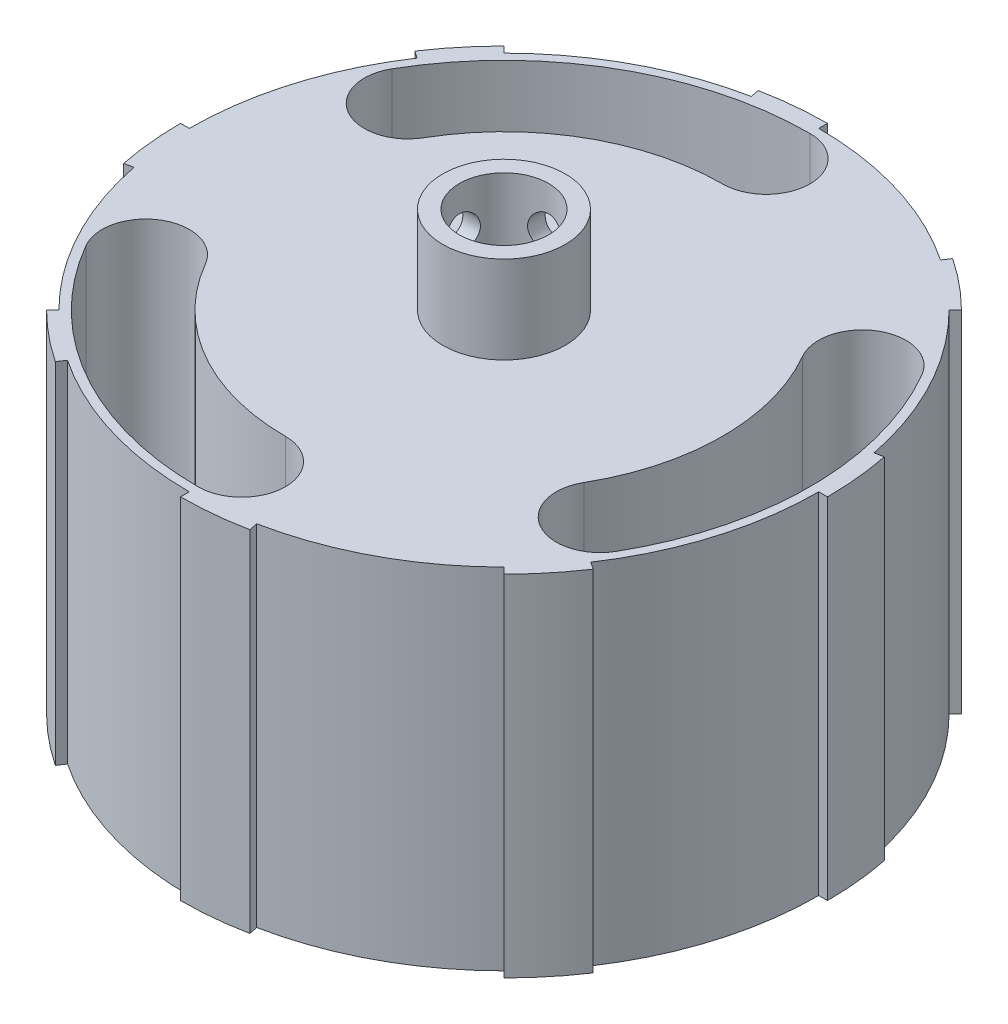
from build123d import *

# Parameters (mm, degrees)
SKETCH_1_R          = 37
EXTRUDE_1_DEPTH     = 40
SKETCH_2_R          = 5.1
CUT_EXTRUDE_1_DEPTH = 40
CUT_EXTRUDE_2_DEPTH = 40
SKETCH_4_R          = 7
SKETCH_4_R_2        = 5.1
EXTRUDE_2_DEPTH     = 10
CUT_EXTRUDE_3_REACH = 74.374
CUT_EXTRUDE_4_REACH = 74.374
CUT_EXTRUDE_7_REACH = 74.374


with BuildPart() as part:
    # 草图1 → 凸台-拉伸1 (new body)
    with BuildSketch(Plane(origin=(0, 0, 0), x_dir=(1, 0, 0), z_dir=(0, 1, 0))):
        Circle(SKETCH_1_R)
    extrude(amount=EXTRUDE_1_DEPTH)

    # 草图2 → 切除-拉伸1 (cut)
    with BuildSketch(Plane(origin=(0, 40, 0), x_dir=(1, 0, 0), z_dir=(0, 1, 0))):
        Circle(SKETCH_2_R)
    extrude(amount=-CUT_EXTRUDE_1_DEPTH, mode=Mode.SUBTRACT)

    # 草图3 → 切除-拉伸2 (cut)
    with BuildSketch(Plane(origin=(0, 40, 0), x_dir=(1, 0, 0), z_dir=(0, 1, 0))):
        with BuildLine():
            ThreePointArc((21.650635067, -12.500000048), (23.480762153, -19.330127042), (30.31088915, -17.499999969))
            ThreePointArc((30.31088915, -17.499999969), (35, 0), (30.31088915, 17.499999969))
            ThreePointArc((30.31088915, 17.499999969), (23.48076214, 19.330127034), (21.650635082, 12.500000023))
            ThreePointArc((21.650635082, 12.500000023), (25, -1.5e-08), (21.650635067, -12.500000048))
        make_face()
        with BuildLine():
            ThreePointArc((-4e-09, 25), (5, 30.000000012), (-2.8e-08, 35))
            ThreePointArc((-2.8e-08, 35), (-17.500000023, 30.310889119), (-30.310889145, 17.499999978))
            ThreePointArc((-30.310889145, 17.499999978), (-28.480762154, 10.669873005), (-21.650635155, 12.499999896))
            ThreePointArc((-21.650635155, 12.499999896), (-12.500000054, 21.650635064), (-4e-09, 25))
        make_face()
        with BuildLine():
            ThreePointArc((1.4e-07, -35), (5, -29.99999992), (-1.9e-08, -25))
            ThreePointArc((-1.9e-08, -25), (-12.499999982, -21.650635105), (-21.650635064, -12.500000053))
            ThreePointArc((-21.650635064, -12.500000053), (-28.480762025, -10.66987293), (-30.310889204, -17.499999877))
            ThreePointArc((-30.310889204, -17.499999877), (-17.500000001, -30.310889132), (1.4e-07, -35))
        make_face()
    extrude(amount=-CUT_EXTRUDE_2_DEPTH, mode=Mode.SUBTRACT)

    # 草图4 → 凸台-拉伸2 (add, symmetric)
    with BuildSketch(Plane(origin=(0, 40, 0), x_dir=(1, 0, 0), z_dir=(0, 1, 0))):
        Circle(SKETCH_4_R)
        Circle(SKETCH_4_R_2, mode=Mode.SUBTRACT)
    extrude(amount=EXTRUDE_2_DEPTH, both=True)

    # 草图6 → 切除-拉伸3 (cut, up to next)
    with BuildSketch(Plane.XY, mode=Mode.PRIVATE) as cut_extrude_3_sk1:
        with BuildLine():
            ThreePointArc((0, 47), (-1.414213562, 43.585786438), (2, 45))
            ThreePointArc((2, 45), (1.414213562, 46.414213562), (0, 47))
        make_face()
    cut_extrude_3_tool1 = extrude(cut_extrude_3_sk1.sketch, amount=-CUT_EXTRUDE_3_REACH, mode=Mode.PRIVATE) & part.part
    add(cut_extrude_3_tool1.solids().sort_by_distance((0, 45, 0))[0], mode=Mode.SUBTRACT)

    # 草图7 → 切除-拉伸4 (cut, up to next)
    with BuildSketch(Plane(origin=(0, 0, 0), x_dir=(0, 0, -1), z_dir=(1, 0, 0)), mode=Mode.PRIVATE) as cut_extrude_4_sk1:
        with BuildLine():
            ThreePointArc((0, 47), (-1.414213562, 43.585786438), (2, 45))
            ThreePointArc((2, 45), (1.414213562, 46.414213562), (0, 47))
        make_face()
    cut_extrude_4_tool1 = extrude(cut_extrude_4_sk1.sketch, amount=-CUT_EXTRUDE_4_REACH, mode=Mode.PRIVATE) & part.part
    add(cut_extrude_4_tool1.solids().sort_by_distance((0, 45, 0))[0], mode=Mode.SUBTRACT)

    # 草图10 → 切除-拉伸7 (cut, up to next)
    with BuildSketch(Plane.XZ, mode=Mode.PRIVATE) as cut_extrude_7_sk1:
        with BuildLine():
            Line((0, 36), (0, 37))
            ThreePointArc((0, 37), (-10.740533058, 35.406792422), (-20.556098622, 30.764375655))
            Line((-20.556098622, 30.764375655), (-20.000528389, 29.932906043))
            ThreePointArc((-20.000528389, 29.932906043), (-10.450248381, 34.449852086), (0, 36))
        make_face()
    cut_extrude_7_tool1 = extrude(cut_extrude_7_sk1.sketch, amount=-CUT_EXTRUDE_7_REACH, mode=Mode.PRIVATE) & part.part
    # 草图10 → 切除-拉伸7 (cut, up to next)
    with BuildSketch(Plane.XZ, mode=Mode.PRIVATE) as cut_extrude_7_sk2:
        with BuildLine():
            Line((7.218341915, 36.289055375), (7.023251593, 35.308270095))
            ThreePointArc((7.023251593, 35.308270095), (16.970282526, 31.749165517), (25.455844123, 25.455844123))
            Line((25.455844123, 25.455844123), (26.162950904, 26.162950904))
            ThreePointArc((26.162950904, 26.162950904), (17.441679263, 32.631086781), (7.218341915, 36.289055375))
        make_face()
    cut_extrude_7_tool2 = extrude(cut_extrude_7_sk2.sketch, amount=-CUT_EXTRUDE_7_REACH, mode=Mode.PRIVATE) & part.part
    # 草图10 → 切除-拉伸7 (cut, up to next)
    with BuildSketch(Plane.XZ, mode=Mode.PRIVATE) as cut_extrude_7_sk3:
        with BuildLine():
            Line((30.764375655, 20.556098622), (29.932906043, 20.000528389))
            ThreePointArc((29.932906043, 20.000528389), (34.449852086, 10.450248381), (36, 0))
            Line((36, 0), (37, 0))
            ThreePointArc((37, 0), (35.406792422, 10.740533058), (30.764375655, 20.556098622))
        make_face()
    cut_extrude_7_tool3 = extrude(cut_extrude_7_sk3.sketch, amount=-CUT_EXTRUDE_7_REACH, mode=Mode.PRIVATE) & part.part
    # 草图10 → 切除-拉伸7 (cut, up to next)
    with BuildSketch(Plane.XZ, mode=Mode.PRIVATE) as cut_extrude_7_sk4:
        with BuildLine():
            Line((36.289055375, -7.218341915), (35.308270095, -7.023251593))
            ThreePointArc((35.308270095, -7.023251593), (31.749165517, -16.970282526), (25.455844123, -25.455844123))
            Line((25.455844123, -25.455844123), (26.162950904, -26.162950904))
            ThreePointArc((26.162950904, -26.162950904), (32.631086781, -17.441679263), (36.289055375, -7.218341915))
        make_face()
    cut_extrude_7_tool4 = extrude(cut_extrude_7_sk4.sketch, amount=-CUT_EXTRUDE_7_REACH, mode=Mode.PRIVATE) & part.part
    # 草图10 → 切除-拉伸7 (cut, up to next)
    with BuildSketch(Plane.XZ, mode=Mode.PRIVATE) as cut_extrude_7_sk5:
        with BuildLine():
            Line((20.556098622, -30.764375655), (20.000528389, -29.932906043))
            ThreePointArc((20.000528389, -29.932906043), (10.450248381, -34.449852086), (0, -36))
            Line((0, -36), (0, -37))
            ThreePointArc((0, -37), (10.740533058, -35.406792422), (20.556098622, -30.764375655))
        make_face()
    cut_extrude_7_tool5 = extrude(cut_extrude_7_sk5.sketch, amount=-CUT_EXTRUDE_7_REACH, mode=Mode.PRIVATE) & part.part
    # 草图10 → 切除-拉伸7 (cut, up to next)
    with BuildSketch(Plane.XZ, mode=Mode.PRIVATE) as cut_extrude_7_sk6:
        with BuildLine():
            Line((-7.218341915, -36.289055375), (-7.023251593, -35.308270095))
            ThreePointArc((-7.023251593, -35.308270095), (-16.970282526, -31.749165517), (-25.455844123, -25.455844123))
            Line((-25.455844123, -25.455844123), (-26.162950904, -26.162950904))
            ThreePointArc((-26.162950904, -26.162950904), (-17.441679263, -32.631086781), (-7.218341915, -36.289055375))
        make_face()
    cut_extrude_7_tool6 = extrude(cut_extrude_7_sk6.sketch, amount=-CUT_EXTRUDE_7_REACH, mode=Mode.PRIVATE) & part.part
    # 草图10 → 切除-拉伸7 (cut, up to next)
    with BuildSketch(Plane.XZ, mode=Mode.PRIVATE) as cut_extrude_7_sk7:
        with BuildLine():
            Line((-30.764375655, -20.556098622), (-29.932906043, -20.000528389))
            ThreePointArc((-29.932906043, -20.000528389), (-34.449852086, -10.450248381), (-36, 0))
            Line((-36, 0), (-37, 0))
            ThreePointArc((-37, 0), (-35.406792422, -10.740533058), (-30.764375655, -20.556098622))
        make_face()
    cut_extrude_7_tool7 = extrude(cut_extrude_7_sk7.sketch, amount=-CUT_EXTRUDE_7_REACH, mode=Mode.PRIVATE) & part.part
    # 草图10 → 切除-拉伸7 (cut, up to next)
    with BuildSketch(Plane.XZ, mode=Mode.PRIVATE) as cut_extrude_7_sk8:
        with BuildLine():
            Line((-36.289055375, 7.218341915), (-35.308270095, 7.023251593))
            ThreePointArc((-35.308270095, 7.023251593), (-31.749165517, 16.970282526), (-25.455844123, 25.455844123))
            Line((-25.455844123, 25.455844123), (-26.162950904, 26.162950904))
            ThreePointArc((-26.162950904, 26.162950904), (-32.631086781, 17.441679263), (-36.289055375, 7.218341915))
        make_face()
    cut_extrude_7_tool8 = extrude(cut_extrude_7_sk8.sketch, amount=-CUT_EXTRUDE_7_REACH, mode=Mode.PRIVATE) & part.part
    add(cut_extrude_7_tool1.solids().sort_by_distance((-0.21737, 0, 36.5))[0], mode=Mode.SUBTRACT)
    add(cut_extrude_7_tool2.solids().sort_by_distance((25.653884, 0, 25.964911))[0], mode=Mode.SUBTRACT)
    add(cut_extrude_7_tool3.solids().sort_by_distance((36.5, 0, 0.21737))[0], mode=Mode.SUBTRACT)
    add(cut_extrude_7_tool4.solids().sort_by_distance((25.964911, 0, -25.653884))[0], mode=Mode.SUBTRACT)
    add(cut_extrude_7_tool5.solids().sort_by_distance((0.21737, 0, -36.5))[0], mode=Mode.SUBTRACT)
    add(cut_extrude_7_tool6.solids().sort_by_distance((-25.653884, 0, -25.964911))[0], mode=Mode.SUBTRACT)
    add(cut_extrude_7_tool7.solids().sort_by_distance((-36.5, 0, -0.21737))[0], mode=Mode.SUBTRACT)
    add(cut_extrude_7_tool8.solids().sort_by_distance((-25.964911, 0, 25.653884))[0], mode=Mode.SUBTRACT)


solid = part.part
